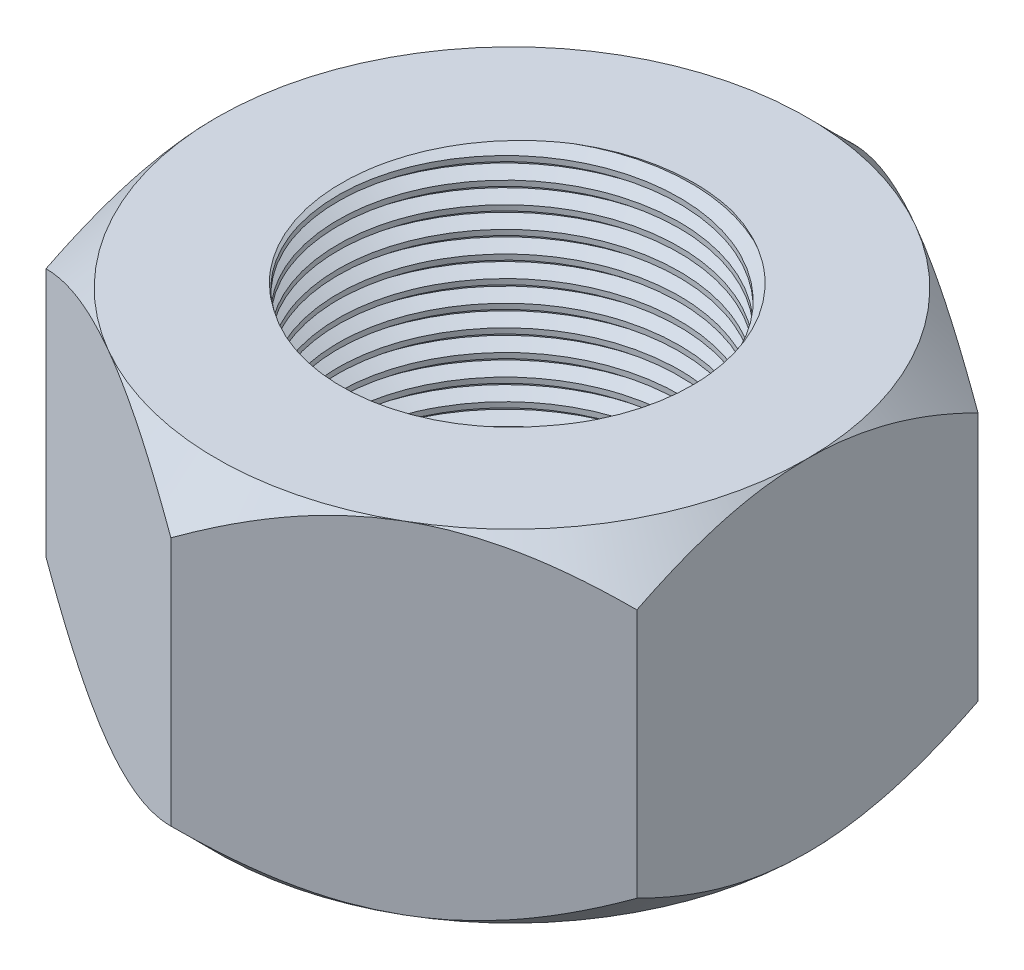
from build123d import *

# Parameters (mm, degrees)
BOSS_EXTRUDE1_DEPTH     = 10
SKETCH3_OUTSIDE_W       = 67.956
SKETCH3_OUTSIDE_H       = 73.314
SKETCH3_OUTSIDE_R       = 17.320508076
CUT_EXTRUDE2_DEPTH      = 10
CUT_EXTRUDE2_DRAFT      = -45
MIRROR1_COPY_1_SKETCH_W = 67.956
MIRROR1_COPY_1_SKETCH_H = 73.314
MIRROR1_COPY_1_SKETCH_R = 17.320508076
MIRROR1_COPY_1_DEPTH    = 10
MIRROR1_COPY_1_DRAFT    = -45
CUT_EXTRUDE3_REACH      = 35.166
SKETCH4_R               = 10
THREAD1_PITCH           = 1.25


with BuildPart() as part:
    # Sketch1 → Boss-Extrude1 (new, symmetric)
    with BuildSketch(Plane(origin=(0, 0, 0), x_dir=(1, 0, 0), z_dir=(0, 1, 0))):
        Polygon((17.320508076, -10), (17.320508076, 10), (0, 20), (-17.320508076, 10), (-17.320508076, -10), (0, -20), align=None)
    extrude(amount=BOSS_EXTRUDE1_DEPTH, both=True)


with BuildPart() as cut_extrude2_tool:
    # Sketch3 outside → Cut-Extrude2 (with draft: the straight prism first)
    with BuildSketch(Plane.XZ.offset(10)):
        Rectangle(SKETCH3_OUTSIDE_W, SKETCH3_OUTSIDE_H)
        Circle(SKETCH3_OUTSIDE_R, mode=Mode.SUBTRACT)
    extrude(amount=-CUT_EXTRUDE2_DEPTH)
    # Cut-Extrude2: the draft: its side faces are tilted about the plane it starts from
    cut_extrude2_sides = [cut_extrude2_tool.faces().sort_by_distance(p)[0] for p in [
        (0, -5, -36.657),
        (33.978, -5, 0),
        (0, -5, 36.657),
        (-33.978, -5, 0),
        (-17.320508076, -5, 0),
    ]]
    draft(cut_extrude2_sides, Plane.XZ.offset(10), CUT_EXTRUDE2_DRAFT)


with BuildPart() as part_1:
    add(part.part)

    # Cut-Extrude2: cut by cut_extrude2_tool
    add(cut_extrude2_tool.part, mode=Mode.SUBTRACT)


with BuildPart() as mirror1_copy_1_tool:
    # Mirror1 copy 1 sketch → Mirror1 copy 1 (with draft: the straight prism first)
    with BuildSketch(Plane(origin=(0, 10, 0), x_dir=(1, 0, 0), z_dir=(0, 1, 0))):
        Rectangle(MIRROR1_COPY_1_SKETCH_W, MIRROR1_COPY_1_SKETCH_H)
        Circle(MIRROR1_COPY_1_SKETCH_R, mode=Mode.SUBTRACT)
    extrude(amount=-MIRROR1_COPY_1_DEPTH)
    # Mirror1 copy 1: the draft: its side faces are tilted about the plane it starts from
    mirror1_copy_1_sides = [mirror1_copy_1_tool.faces().sort_by_distance(p)[0] for p in [
        (0, 5, -36.657),
        (33.978, 5, 0),
        (0, 5, 36.657),
        (-33.978, 5, 0),
        (-17.320508076, 5, 0),
    ]]
    draft(mirror1_copy_1_sides, Plane(origin=(0, 10, 0), x_dir=(1, 0, 0), z_dir=(0, 1, 0)), MIRROR1_COPY_1_DRAFT)


with BuildPart() as part_2:
    add(part_1.part)

    # Mirror1 copy 1: cut by mirror1_copy_1_tool
    add(mirror1_copy_1_tool.part, mode=Mode.SUBTRACT)

    # Sketch4 → Cut-Extrude3 (cut, up to next)
    with BuildSketch(Plane(origin=(0, 10, 0), x_dir=(1, 0, 0), z_dir=(0, 1, 0)), mode=Mode.PRIVATE) as cut_extrude3_sk1:
        with Locations(Location((0, 0, 0), (0, 0, 270))):
            Circle(SKETCH4_R)
    cut_extrude3_tool1 = extrude(cut_extrude3_sk1.sketch, amount=-CUT_EXTRUDE3_REACH, mode=Mode.PRIVATE) & part_2.part
    add(cut_extrude3_tool1.solids().sort_by_distance((0, 10, 0))[0], mode=Mode.SUBTRACT)

    # Thread1: the profile of Thread Profile1 profile screwed along a right-hand helix of 19.2 turns, 8 arcs to a turn; built about Z, then put on its axis
    thread1_z = Axis((0, 0, 0), (0, 0, 1))
    thread1_corners = [(9.9997, 0, -0.000173205), (10.676582344, 0, 0.390624998), (10.676582344, 0, 0.546874998), (9.9997, 0, 0.937673202)]
    with BuildLine(mode=Mode.PRIVATE) as thread1_profile:
        Line(thread1_corners[0], thread1_corners[1])
        Line(thread1_corners[1], thread1_corners[2])
        Line(thread1_corners[2], thread1_corners[3])
        Line(thread1_corners[3], thread1_corners[0])
    thread1_cap = Face(thread1_profile.wire())
    thread1_turn_angles = [0, 22.5, 45, 67.5, 90, 112.5, 135, 157.5, 180, 202.5, 225, 247.5, 270, 292.5, 315, 337.5, 360]
    thread1_turn_weights = [1, 0.9238795325112867, 1, 0.9238795325112867, 1, 0.9238795325112867, 1, 0.9238795325112867, 1, 0.9238795325112867, 1, 0.9238795325112867, 1, 0.9238795325112867, 1, 0.9238795325112867, 1]
    thread1_turn_rails = [Edge.make_bspline([Vector(p[0], p[1], 0).rotate(thread1_z, thread1_turn_angles[k]) / thread1_turn_weights[k] + Vector(0, 0, p[2] + THREAD1_PITCH * thread1_turn_angles[k] / 360) for k in range(17)], [0, 0, 0, 1, 1, 2, 2, 3, 3, 4, 4, 5, 5, 6, 6, 7, 7, 8, 8, 8], 2, thread1_turn_weights) for p in thread1_corners]
    thread1_turn_sides = [Face.make_surface_from_curves(thread1_turn_rails[p[0]], thread1_turn_rails[p[1]]) for p in [(0, 1), (1, 2), (2, 3), (3, 0)]]
    thread1_last_angles = [6840, 6862.5, 6885, 6898.5, 6912]
    thread1_last_weights = [1, 0.9238795325112867, 1, 0.9723699203976766, 1]
    thread1_last_rails = [Edge.make_bspline([Vector(p[0], p[1], 0).rotate(thread1_z, thread1_last_angles[k]) / thread1_last_weights[k] + Vector(0, 0, p[2] + THREAD1_PITCH * thread1_last_angles[k] / 360) for k in range(5)], [0, 0, 0, 1, 1, 2, 2, 2], 2, thread1_last_weights) for p in thread1_corners]
    thread1_last_sides = [Face.make_surface_from_curves(thread1_last_rails[p[0]], thread1_last_rails[p[1]]) for p in [(0, 1), (1, 2), (2, 3), (3, 0)]]
    thread1 = Plane(origin=(0, 12, 0), x_dir=(-1, 0, 0), z_dir=(0, -1, 0)) * Solid(Shell([*[p.moved(Location((0, 0, THREAD1_PITCH * i))) for i in range(19) for p in thread1_turn_sides], *thread1_last_sides, thread1_cap, thread1_cap.rotate(thread1_z, 6912).moved(Location((0, 0, THREAD1_PITCH * 6912 / 360)))]))
    add(thread1, mode=Mode.SUBTRACT)


solid = part_2.part
